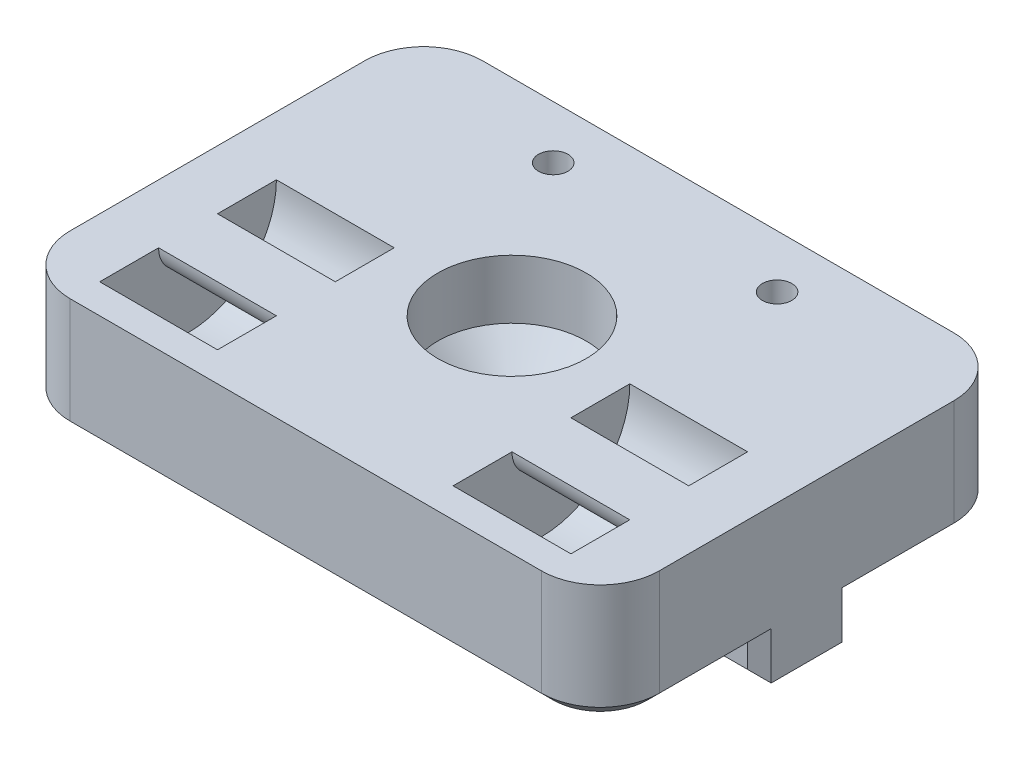
from build123d import *

# Parameters (mm, degrees)
BOSS_EXTRUDE1_DEPTH   = 25
CUT_EXTRUDE1_DEPTH    = 5
FILLET1_R             = 5
CHAMFER1_SIZE         = 1
M3X0_5_TAPPED_HOLE1_D = 2.5


with BuildPart() as part:
    # Sketch1 → Boss-Extrude1 (new, symmetric)
    with BuildSketch(Plane(origin=(0, 0, 0), x_dir=(0, 0, -1), z_dir=(1, 0, 0))):
        Polygon((-17.5, 10), (17.5, 10), (17.5, 0), (4, 0), (4, -3), (-4, -3), (-4, 0), (-17.5, 0), align=None)
    extrude(amount=BOSS_EXTRUDE1_DEPTH, both=True)

    # Sketch3 → CSK for M6 Flat Head Machine Screw1 (revolve, cut)
    with BuildSketch(Plane(origin=(0, 10, 0), x_dir=(0, 0, 1), z_dir=(1, 0, 0))):
        Polygon((0, 0), (0, 13), (3.3, 13), (3.3, 8), (6.3, 5), (6.3, 0), align=None)
    revolve(axis=Axis((0, 16.35, 0), (0, -1, 0)), mode=Mode.SUBTRACT)

    # Sketch4 → Cut-Extrude1 (cut, symmetric)
    with BuildSketch(Plane(origin=(15, 0, 0), x_dir=(0, 0, -1), z_dir=(1, 0, 0))):
        with BuildLine():
            Line((-15, 10), (-10, 10))
            ThreePointArc((-10, 10), (-7.5, 7.5), (-5, 10))
            Line((-5, 10), (0, 10))
            ThreePointArc((0, 10), (-7.5, 2.5), (-15, 10))
        make_face()
    cut_extrude1 = extrude(amount=CUT_EXTRUDE1_DEPTH, both=True, mode=Mode.SUBTRACT)

    # Mirror1: Cut-Extrude1 across plane
    add(cut_extrude1.mirror(Plane(origin=(0, 0, 0), x_dir=(0, 0, 1), z_dir=(1, 0, 0))), mode=Mode.SUBTRACT)

    # Fillet1
    fillet1_edges = [part.edges().sort_by_distance(p)[0] for p in [
        (-25, 5, 17.5),
        (25, 5, -17.5),
        (25, 5, 17.5),
        (-25, 5, -17.5),
    ]]
    fillet(fillet1_edges, radius=FILLET1_R)

    # Chamfer1
    # the kernel refuses this chamfer: 1 mm, written as the material it takes off along each edge
    with BuildSketch(Plane(origin=(-25, -5.571682988, 4), x_dir=(-0.027495876610585623, 0, -0.9996219169112968), z_dir=(0, 1, 0)), Plane(origin=(-25, 0, -4), x_dir=(-0.027495876610585623, 0, 0.9996219169112968), z_dir=(0, -1, 0))) as chamfer1_piece_1:
        Polygon((CHAMFER1_SIZE * 0.999621916911, -CHAMFER1_SIZE * 0.0274958766106), (-CHAMFER1_SIZE * 0.0274958766106, -CHAMFER1_SIZE * 0.999621916911), (0, 0), align=None)
    extrude(amount=5.571682988, mode=Mode.SUBTRACT)
    with BuildSketch(Plane(origin=(25, -5.571682988, 4), x_dir=(0.027495876610585623, 0, -0.9996219169112968), z_dir=(0, 1, 0)), Plane(origin=(25, 0, -4), x_dir=(0.027495876610585623, 0, 0.9996219169112968), z_dir=(0, -1, 0))) as chamfer1_piece_2:
        Polygon((CHAMFER1_SIZE * 0.999621916911, CHAMFER1_SIZE * 0.0274958766106), (-CHAMFER1_SIZE * 0.0274958766106, CHAMFER1_SIZE * 0.999621916911), (0, 0), align=None)
    extrude(amount=5.571682988, mode=Mode.SUBTRACT)
    with BuildSketch(Plane(origin=(27.571682988, -3, -4), x_dir=(0, 0.9996219169112968, -0.027495876610586494), z_dir=(-1, 0, 0))) as chamfer1_piece_3:
        Polygon((CHAMFER1_SIZE * 0.999621916911, -CHAMFER1_SIZE * 0.0274958766106), (-CHAMFER1_SIZE * 0.0274958766106, -CHAMFER1_SIZE * 0.999621916911), (0, 0), align=None)
    extrude(amount=55.143365976, mode=Mode.SUBTRACT)
    with BuildSketch(Plane(origin=(27.571682988, -3, 4), x_dir=(0, 0.9996219169112968, 0.027495876610586494), z_dir=(-1, 0, 0))) as chamfer1_piece_4:
        Polygon((CHAMFER1_SIZE * 0.999621916911, CHAMFER1_SIZE * 0.0274958766106), (-CHAMFER1_SIZE * 0.0274958766106, CHAMFER1_SIZE * 0.999621916911), (0, 0), align=None)
    extrude(amount=55.143365976, mode=Mode.SUBTRACT)
    with BuildSketch(Plane(origin=(25, 0, -12.5), x_dir=(0.027495876610585623, 0.9996219169112968, 0), z_dir=(0, 0, 1)), Plane(origin=(25, 0, 4), x_dir=(0.02749587661058563, 0.9996219169112968, 0), z_dir=(0, 0, 1))) as chamfer1_piece_5:
        Polygon((CHAMFER1_SIZE * 0.999621916911, CHAMFER1_SIZE * 0.0274958766106), (-CHAMFER1_SIZE * 0.0274958766106, CHAMFER1_SIZE * 0.999621916911), (0, 0), align=None)
    extrude(amount=8.5, mode=Mode.SUBTRACT)
    with BuildSketch(Plane(origin=(-25, 0, 4), x_dir=(-0.02749587661058563, 0.9996219169112968, 0), z_dir=(0, 0, 1)), Plane(origin=(-25, 0, -12.5), x_dir=(-0.027495876610585623, 0.9996219169112968, 0), z_dir=(0, 0, 1))) as chamfer1_piece_6:
        Polygon((CHAMFER1_SIZE * 0.999621916911, -CHAMFER1_SIZE * 0.0274958766106), (-CHAMFER1_SIZE * 0.0274958766106, -CHAMFER1_SIZE * 0.999621916911), (0, 0), align=None)
    extrude(amount=8.5, mode=Mode.SUBTRACT)
    with BuildSketch(Plane(origin=(-20, 0, 17.5), x_dir=(0, 0.9996219169112968, 0.02749587661058563), z_dir=(1, 0, 0)), Plane(origin=(20, 0, -17.5), x_dir=(0, 0.9996219169112968, -0.027495876610585623), z_dir=(-1, 0, 0))) as chamfer1_piece_7:
        Polygon((CHAMFER1_SIZE * 0.999621916911, -CHAMFER1_SIZE * 0.0274958766106), (-CHAMFER1_SIZE * 0.0274958766106, -CHAMFER1_SIZE * 0.999621916911), (0, 0), align=None)
    extrude(amount=40, mode=Mode.SUBTRACT)
    with BuildSketch(Plane(origin=(-20, 0, 12.5), x_dir=(0, 0, 1), z_dir=(1, 0, 0))) as chamfer1_piece_8:
        Polygon((5, -CHAMFER1_SIZE), (5 - CHAMFER1_SIZE, 0), (5, 0), align=None)
    revolve(axis=Axis((-20, 0, 12.5), (0, -1, 0)), revolution_arc=90, mode=Mode.SUBTRACT)
    with BuildSketch(Plane(origin=(20, 0, 12.5), x_dir=(0, 0, 1), z_dir=(-1, 0, 0))) as chamfer1_piece_9:
        Polygon((5, CHAMFER1_SIZE), (5 - CHAMFER1_SIZE, 0), (5, 0), align=None)
    revolve(axis=Axis((20, 0, 12.5), (0, 1, 0)), revolution_arc=90, mode=Mode.SUBTRACT)
    with BuildSketch(Plane(origin=(-20, 0, -12.5), x_dir=(-1, 0, 0), z_dir=(0, 0, 1))) as chamfer1_piece_10:
        Polygon((5, -CHAMFER1_SIZE), (5 - CHAMFER1_SIZE, 0), (5, 0), align=None)
    revolve(axis=Axis((-20, 0, -12.5), (0, -1, 0)), revolution_arc=90, mode=Mode.SUBTRACT)
    with BuildSketch(Plane(origin=(20, 0, -12.5), x_dir=(1, 0, 0), z_dir=(0, 0, 1))) as chamfer1_piece_11:
        Polygon((5, CHAMFER1_SIZE), (5 - CHAMFER1_SIZE, 0), (5, 0), align=None)
    revolve(axis=Axis((20, 0, -12.5), (0, 1, 0)), revolution_arc=90, mode=Mode.SUBTRACT)
    with BuildSketch(Plane(origin=(-25, 0, 1.428317012), x_dir=(-0.02749587661058563, 0.9996219169112968, 0), z_dir=(0, 0, 1))) as chamfer1_piece_12a_section:
        Polygon((CHAMFER1_SIZE * 0.999621916911, -CHAMFER1_SIZE * 0.0274958766106), (-CHAMFER1_SIZE * 0.0274958766106, -CHAMFER1_SIZE * 0.999621916911), (0, 0), align=None)
    chamfer1_piece_12a = extrude(amount=11.071682988, mode=Mode.PRIVATE)
    chamfer1_piece_12a = split(chamfer1_piece_12a, bisect_by=Plane(origin=(-24.670206373, 0.329793627, 4), z_dir=(0, 0, -1)), keep=Keep.TOP, mode=Mode.PRIVATE)
    with BuildSketch(Plane(origin=(-25, -5.571682988, 4), x_dir=(-0.027495876610585623, 0, -0.9996219169112968), z_dir=(0, 1, 0))) as chamfer1_piece_12b_section:
        Polygon((CHAMFER1_SIZE * 0.999621916911, -CHAMFER1_SIZE * 0.0274958766106), (-CHAMFER1_SIZE * 0.0274958766106, -CHAMFER1_SIZE * 0.999621916911), (0, 0), align=None)
    chamfer1_piece_12b = extrude(amount=8.143365976, mode=Mode.PRIVATE)
    chamfer1_piece_12b = split(chamfer1_piece_12b, bisect_by=Plane(origin=(-24.670206373, 0, 3.670206373), z_dir=(0, 1, 0)), keep=Keep.TOP, mode=Mode.PRIVATE)
    chamfer1_piece_12 = chamfer1_piece_12a & chamfer1_piece_12b
    add(chamfer1_piece_12, mode=Mode.SUBTRACT)
    with BuildSketch(Plane(origin=(25, 0, 1.428317012), x_dir=(0.02749587661058563, 0.9996219169112968, 0), z_dir=(0, 0, 1))) as chamfer1_piece_13a_section:
        Polygon((CHAMFER1_SIZE * 0.999621916911, CHAMFER1_SIZE * 0.0274958766106), (-CHAMFER1_SIZE * 0.0274958766106, CHAMFER1_SIZE * 0.999621916911), (0, 0), align=None)
    chamfer1_piece_13a = extrude(amount=11.071682988, mode=Mode.PRIVATE)
    chamfer1_piece_13a = split(chamfer1_piece_13a, bisect_by=Plane(origin=(24.670206373, 0.329793627, 4), z_dir=(0, 0, -1)), keep=Keep.TOP, mode=Mode.PRIVATE)
    with BuildSketch(Plane(origin=(25, -5.571682988, 4), x_dir=(0.027495876610585623, 0, -0.9996219169112968), z_dir=(0, 1, 0))) as chamfer1_piece_13b_section:
        Polygon((CHAMFER1_SIZE * 0.999621916911, CHAMFER1_SIZE * 0.0274958766106), (-CHAMFER1_SIZE * 0.0274958766106, CHAMFER1_SIZE * 0.999621916911), (0, 0), align=None)
    chamfer1_piece_13b = extrude(amount=8.143365976, mode=Mode.PRIVATE)
    chamfer1_piece_13b = split(chamfer1_piece_13b, bisect_by=Plane(origin=(24.670206373, 0, 3.670206373), z_dir=(0, 1, 0)), keep=Keep.TOP, mode=Mode.PRIVATE)
    chamfer1_piece_13 = chamfer1_piece_13a & chamfer1_piece_13b
    add(chamfer1_piece_13, mode=Mode.SUBTRACT)
    with BuildSketch(Plane(origin=(25, 0, -12.5), x_dir=(0.027495876610585623, 0.9996219169112968, 0), z_dir=(0, 0, 1))) as chamfer1_piece_14a_section:
        Polygon((CHAMFER1_SIZE * 0.999621916911, CHAMFER1_SIZE * 0.0274958766106), (-CHAMFER1_SIZE * 0.0274958766106, CHAMFER1_SIZE * 0.999621916911), (0, 0), align=None)
    chamfer1_piece_14a = extrude(amount=11.071682988, mode=Mode.PRIVATE)
    chamfer1_piece_14a = split(chamfer1_piece_14a, bisect_by=Plane(origin=(24.670206373, 0.329793627, -4), z_dir=(0, 0, 1)), keep=Keep.TOP, mode=Mode.PRIVATE)
    with BuildSketch(Plane(origin=(25, 2.571682988, -4), x_dir=(0.027495876610585623, 0, 0.9996219169112968), z_dir=(0, -1, 0))) as chamfer1_piece_14b_section:
        Polygon((CHAMFER1_SIZE * 0.999621916911, CHAMFER1_SIZE * 0.0274958766106), (-CHAMFER1_SIZE * 0.0274958766106, CHAMFER1_SIZE * 0.999621916911), (0, 0), align=None)
    chamfer1_piece_14b = extrude(amount=8.143365976, mode=Mode.PRIVATE)
    chamfer1_piece_14b = split(chamfer1_piece_14b, bisect_by=Plane(origin=(24.670206373, 0, -3.670206373), z_dir=(0, 1, 0)), keep=Keep.TOP, mode=Mode.PRIVATE)
    chamfer1_piece_14 = chamfer1_piece_14a & chamfer1_piece_14b
    add(chamfer1_piece_14, mode=Mode.SUBTRACT)
    with BuildSketch(Plane(origin=(-25, 0, -12.5), x_dir=(-0.027495876610585623, 0.9996219169112968, 0), z_dir=(0, 0, 1))) as chamfer1_piece_15a_section:
        Polygon((CHAMFER1_SIZE * 0.999621916911, -CHAMFER1_SIZE * 0.0274958766106), (-CHAMFER1_SIZE * 0.0274958766106, -CHAMFER1_SIZE * 0.999621916911), (0, 0), align=None)
    chamfer1_piece_15a = extrude(amount=11.071682988, mode=Mode.PRIVATE)
    chamfer1_piece_15a = split(chamfer1_piece_15a, bisect_by=Plane(origin=(-24.670206373, 0.329793627, -4), z_dir=(0, 0, 1)), keep=Keep.TOP, mode=Mode.PRIVATE)
    with BuildSketch(Plane(origin=(-25, 2.571682988, -4), x_dir=(-0.027495876610585623, 0, 0.9996219169112968), z_dir=(0, -1, 0))) as chamfer1_piece_15b_section:
        Polygon((CHAMFER1_SIZE * 0.999621916911, -CHAMFER1_SIZE * 0.0274958766106), (-CHAMFER1_SIZE * 0.0274958766106, -CHAMFER1_SIZE * 0.999621916911), (0, 0), align=None)
    chamfer1_piece_15b = extrude(amount=8.143365976, mode=Mode.PRIVATE)
    chamfer1_piece_15b = split(chamfer1_piece_15b, bisect_by=Plane(origin=(-24.670206373, 0, -3.670206373), z_dir=(0, 1, 0)), keep=Keep.TOP, mode=Mode.PRIVATE)
    chamfer1_piece_15 = chamfer1_piece_15a & chamfer1_piece_15b
    add(chamfer1_piece_15, mode=Mode.SUBTRACT)

    # M3x0.5 Tapped Hole1 (through all)
    with Locations(Plane(origin=(0, 10, 0), x_dir=(1, 0, 0), z_dir=(0, 1, 0))):
        with Locations((-9.5, 13), (9.5, 13)):
            Hole(M3X0_5_TAPPED_HOLE1_D / 2)


solid = part.part
